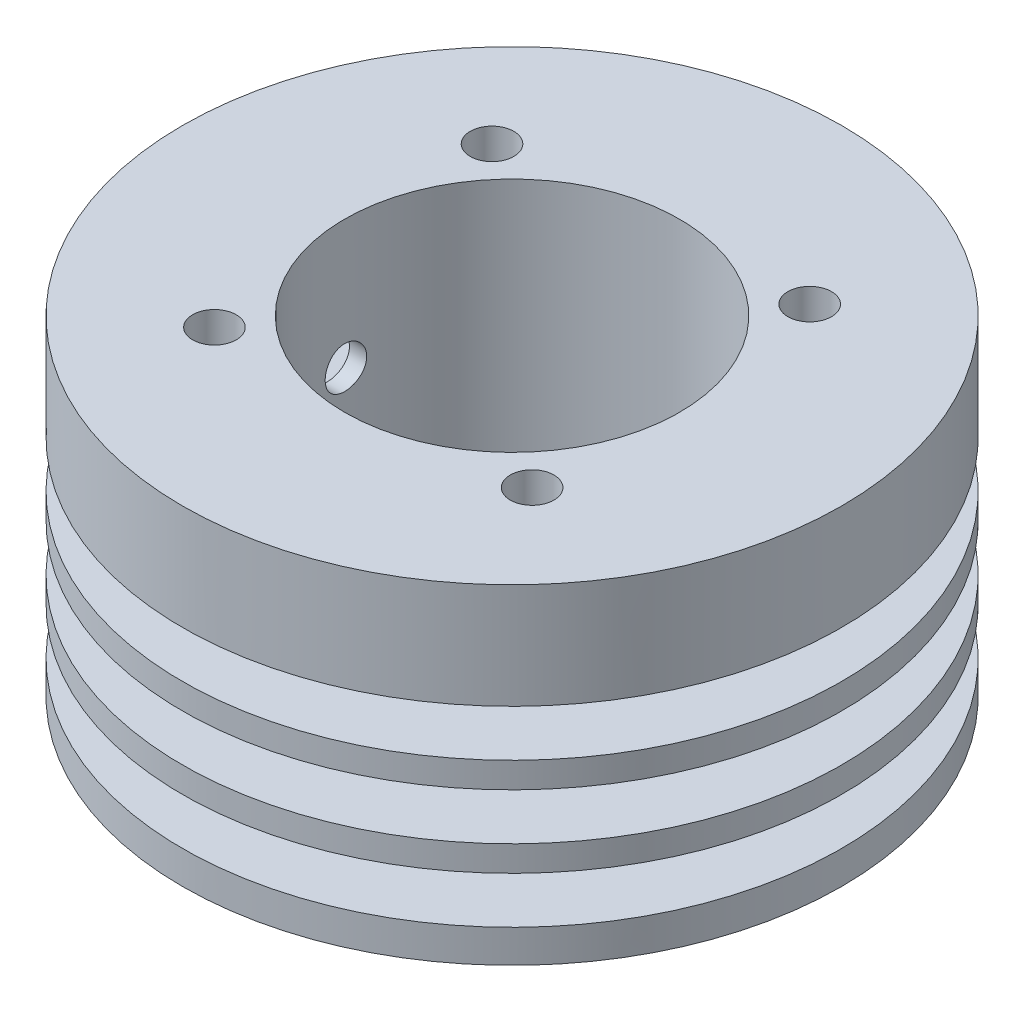
from build123d import *

# Parameters (mm, degrees)
SKETCH1_R                        = 31.75
SKETCH1_R_2                      = 16.129
BOSS_EXTRUDE1_DEPTH              = 31.75
SKETCH2_W                        = 13.97
SKETCH2_H                        = 4.5
BOSS_EXTRUDE2_START              = -7.675
BOSS_EXTRUDE2_OUTLINE_R          = 31.75
BOSS_EXTRUDE2_OUTLINE_R_2        = 17.78
BOSS_EXTRUDE2_DEPTH              = 4.5
CUT_EXTRUDE2_REACH               = 56.993
CUT_EXTRUDE2_END_RADIUS          = 17.78
SKETCH8_R                        = 2
CUT_EXTRUDE3_REACH               = 56.993
CUT_EXTRUDE3_END_RADIUS          = 17.78
SKETCH9_R                        = 2
SKETCH10_R                       = 1
CUT_EXTRUDE4_DEPTH               = 10.141666667
TAP_DRILL_FOR_M5X0_8_TAP1_REACH  = 74.51
TAP_DRILL_FOR_M5X0_8_TAP1_BORE_R = 2.1


# Read off the part's stored shape, not the designer's step: Boss-Extrude2
with BuildPart() as part:
    # Sketch1 → Boss-Extrude1 (new body)
    with BuildSketch(Plane(origin=(0, 0, 0), x_dir=(1, 0, 0), z_dir=(0, 1, 0))):
        with Locations(Location((0, 0, 0), (0, 0, 270))):
            Circle(SKETCH1_R)
        with Locations(Location((0, 0, 0), (0, 0, 270))):
            Circle(SKETCH1_R_2, mode=Mode.SUBTRACT)
    extrude(amount=BOSS_EXTRUDE1_DEPTH)

    # Sketch2 → Cut-Revolve2 (revolve, cut)
    with BuildSketch(Plane.XY, mode=Mode.PRIVATE) as cut_revolve2_sk:
        with Locations((24.765, 26.325)):
            Rectangle(SKETCH2_W, SKETCH2_H)
        with Locations((24.765, 12.391666667)):
            Rectangle(SKETCH2_W, SKETCH2_H)
        with Locations((24.765, 5.425)):
            Rectangle(SKETCH2_W, SKETCH2_H)
        with Locations((24.765, 19.358333333)):
            Rectangle(SKETCH2_W, SKETCH2_H)
    revolve(cut_revolve2_sk.sketch.rotate(Axis((0, 0, 0), (0, 1, 0)), 90), axis=Axis((0, 0, 0), (0, 1, 0)), mode=Mode.SUBTRACT)

    # Boss-Extrude2 outline → Boss-Extrude2 (add)
    with BuildSketch(Plane(origin=(0, 31.75, 0), x_dir=(1, 0, 0), z_dir=(0, 1, 0)).offset(BOSS_EXTRUDE2_START)):
        Circle(BOSS_EXTRUDE2_OUTLINE_R)
        with BuildLine():
            ThreePointArc((18.265610967, -10.406997066), (18.915681572, -11.247857531), (19.33332562, -12.225206784))
            ThreePointArc((19.33332562, -12.225206784), (18.780593277, -11.327185978), (18.265610967, -10.406997066))
        make_face(mode=Mode.SUBTRACT)
        Circle(BOSS_EXTRUDE2_OUTLINE_R_2, mode=Mode.SUBTRACT)
    extrude(amount=BOSS_EXTRUDE2_DEPTH)

    # Cut-Extrude2: up to this cylinder (the profile starts inside it)
    cut_extrude2_end = Plane(origin=(0, 19.358333, 0), z_dir=(0, -1, 0)) * Cylinder(CUT_EXTRUDE2_END_RADIUS, 150.546, mode=Mode.PRIVATE)
    # Sketch8 → Cut-Extrude2 (cut, up to the surface)
    with BuildSketch(Plane.XY, mode=Mode.PRIVATE) as cut_extrude2_sk1:
        with Locations(Location((0, 19.358333333, 0), (0, 0, 180))):
            Circle(SKETCH8_R)
    cut_extrude2_tool1 = extrude(cut_extrude2_sk1.sketch, amount=CUT_EXTRUDE2_REACH, mode=Mode.PRIVATE) & cut_extrude2_end
    add(cut_extrude2_tool1.solids().sort_by_distance((0, 19.358333, 0))[0], mode=Mode.SUBTRACT)

    # Cut-Extrude3: up to this cylinder (the profile starts inside it)
    cut_extrude3_end = Plane(origin=(0, 19.358333, 0), z_dir=(0, -1, 0)) * Cylinder(CUT_EXTRUDE3_END_RADIUS, 150.546, mode=Mode.PRIVATE)
    # Sketch9 → Cut-Extrude3 (cut, up to the surface)
    with BuildSketch(Plane(origin=(0, 0, 0), x_dir=(0, 0, -1), z_dir=(1, 0, 0)), mode=Mode.PRIVATE) as cut_extrude3_sk1:
        with Locations((0, 19.358333333)):
            Circle(SKETCH9_R)
    cut_extrude3_tool1 = extrude(cut_extrude3_sk1.sketch, amount=-CUT_EXTRUDE3_REACH, mode=Mode.PRIVATE) & cut_extrude3_end
    add(cut_extrude3_tool1.solids().sort_by_distance((0, 19.358333, 0))[0], mode=Mode.SUBTRACT)

    # Sketch10 → Cut-Extrude4 (cut)
    with BuildSketch(Plane(origin=(0, 31.75, 0), x_dir=(1, 0, 0), z_dir=(0, 1, 0))):
        with Locations(Location((15.301734948, -13.370090036, 0), (0, 0, 270))):
            Circle(SKETCH10_R)
        with Locations(Location((13.370090036, 15.301734948, 0), (0, 0, 270))):
            Circle(SKETCH10_R)
        with Locations(Location((-15.301734948, 13.370090036, 0), (0, 0, 270))):
            Circle(SKETCH10_R)
        with Locations(Location((-13.370090036, -15.301734948, 0), (0, 0, 270))):
            Circle(SKETCH10_R)
    extrude(amount=-CUT_EXTRUDE4_DEPTH, mode=Mode.SUBTRACT)

    # Tap Drill for M5x0.8 Tap1 bore (on position points) → Tap Drill for M5x0.8 Tap1 (cut, up to next)
    with BuildSketch(Plane(origin=(15.301734948, 31.75, 13.370090036), x_dir=(0, 0, 1), z_dir=(0, 1, 0)), mode=Mode.PRIVATE) as tap_drill_for_m5x0_8_tap1_sk1:
        Circle(TAP_DRILL_FOR_M5X0_8_TAP1_BORE_R)
    tap_drill_for_m5x0_8_tap1_tool1 = extrude(tap_drill_for_m5x0_8_tap1_sk1.sketch, amount=-TAP_DRILL_FOR_M5X0_8_TAP1_REACH, mode=Mode.PRIVATE) & part.part
    # Tap Drill for M5x0.8 Tap1 bore (on position points) → Tap Drill for M5x0.8 Tap1 (cut, up to next)
    with BuildSketch(Plane(origin=(15.301734948, 31.75, 13.370090036), x_dir=(0, 0, 1), z_dir=(0, 1, 0)), mode=Mode.PRIVATE) as tap_drill_for_m5x0_8_tap1_sk2:
        with Locations((1.931644912, -28.671824984)):
            Circle(TAP_DRILL_FOR_M5X0_8_TAP1_BORE_R)
    tap_drill_for_m5x0_8_tap1_tool2 = extrude(tap_drill_for_m5x0_8_tap1_sk2.sketch, amount=-TAP_DRILL_FOR_M5X0_8_TAP1_REACH, mode=Mode.PRIVATE) & part.part
    # Tap Drill for M5x0.8 Tap1 bore (on position points) → Tap Drill for M5x0.8 Tap1 (cut, up to next)
    with BuildSketch(Plane(origin=(15.301734948, 31.75, 13.370090036), x_dir=(0, 0, 1), z_dir=(0, 1, 0)), mode=Mode.PRIVATE) as tap_drill_for_m5x0_8_tap1_sk3:
        with Locations((-26.740180072, -30.603469896)):
            Circle(TAP_DRILL_FOR_M5X0_8_TAP1_BORE_R)
    tap_drill_for_m5x0_8_tap1_tool3 = extrude(tap_drill_for_m5x0_8_tap1_sk3.sketch, amount=-TAP_DRILL_FOR_M5X0_8_TAP1_REACH, mode=Mode.PRIVATE) & part.part
    # Tap Drill for M5x0.8 Tap1 bore (on position points) → Tap Drill for M5x0.8 Tap1 (cut, up to next)
    with BuildSketch(Plane(origin=(15.301734948, 31.75, 13.370090036), x_dir=(0, 0, 1), z_dir=(0, 1, 0)), mode=Mode.PRIVATE) as tap_drill_for_m5x0_8_tap1_sk4:
        with Locations((-28.671824984, -1.931644912)):
            Circle(TAP_DRILL_FOR_M5X0_8_TAP1_BORE_R)
    tap_drill_for_m5x0_8_tap1_tool4 = extrude(tap_drill_for_m5x0_8_tap1_sk4.sketch, amount=-TAP_DRILL_FOR_M5X0_8_TAP1_REACH, mode=Mode.PRIVATE) & part.part
    add(tap_drill_for_m5x0_8_tap1_tool1.solids().sort_by_distance((15.301735, 31.75, 13.37009))[0], mode=Mode.SUBTRACT)
    add(tap_drill_for_m5x0_8_tap1_tool2.solids().sort_by_distance((-13.37009, 31.75, 15.301735))[0], mode=Mode.SUBTRACT)
    add(tap_drill_for_m5x0_8_tap1_tool3.solids().sort_by_distance((-15.301735, 31.75, -13.37009))[0], mode=Mode.SUBTRACT)
    add(tap_drill_for_m5x0_8_tap1_tool4.solids().sort_by_distance((13.37009, 31.75, -15.301735))[0], mode=Mode.SUBTRACT)


solid = part.part
